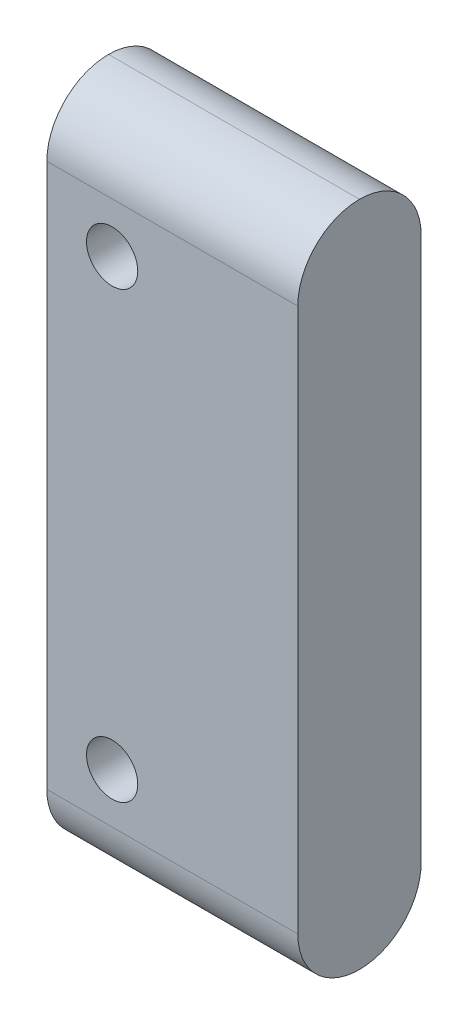
from build123d import *

# Parameters (mm, degrees)
SKETCH1_R      = 3.2999934
EXTRUDE1_DEPTH = 15.875
FILLET1_R      = 7.9375


with BuildPart() as part:
    # Sketch1 → Extrude1 (new body)
    with BuildSketch(Plane.XY):
        Polygon((131.1183814, 88.3896378), (98.8183698, 88.3592086), (98.8183698, 174.2591892), (131.1183814, 174.2591892), align=None)
        with Locations((107.2183784, 102.7091926)):
            Circle(SKETCH1_R, mode=Mode.SUBTRACT)
        with Locations((107.2183784, 159.9092052)):
            Circle(SKETCH1_R, mode=Mode.SUBTRACT)
    extrude(amount=-EXTRUDE1_DEPTH)

    # Fillet1
    fillet1_edges = [part.edges().sort_by_distance(p)[0] for p in [
        (114.9683756, 88.3744232, -15.875),
        (114.9683756, 88.3744232, 0),
        (114.9683756, 174.2591892, -15.875),
        (114.9683756, 174.2591892, 0),
    ]]
    fillet(fillet1_edges, radius=FILLET1_R - 0.0001)  # a hair under: the kernel refuses the full size


solid = part.part
